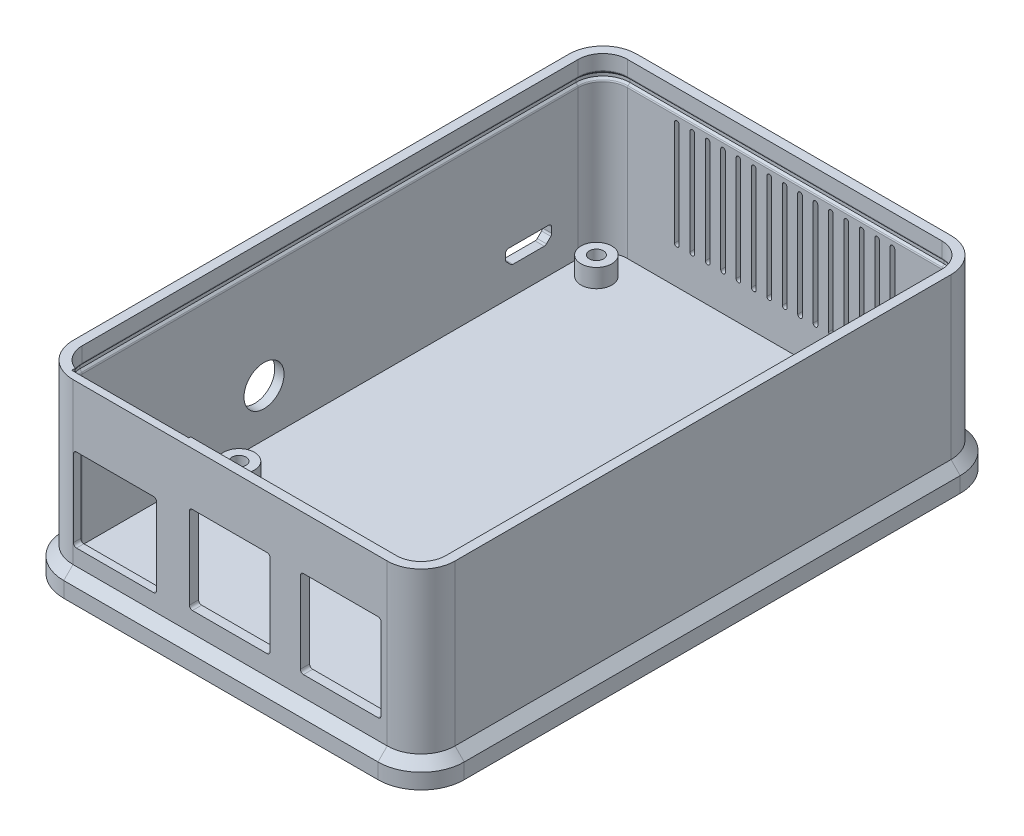
from build123d import *

# Parameters (mm, degrees)
BOSS_EXTRUDE1_DEPTH      = 25
BOSS_EXTRUDE1_DEPTH_BACK = 3
BOSS_EXTRUDE2_START      = 2
BOSS_EXTRUDE2_DEPTH      = 2
SKETCH7_R                = 3.25
CUT_EXTRUDE1_DEPTH       = 1.5
FILLET1_R                = 0.5
SKETCH8_W                = 13.1
SKETCH8_H                = 14.2
SKETCH8_W_2              = 13.5
SKETCH8_H_2              = 13.5
CUT_EXTRUDE2_DEPTH       = 1.5
FILLET2_R                = 0.5
CUT_EXTRUDE3_DEPTH       = 64.158530699
SKETCH10_R               = 2.5
SKETCH10_R_2             = 1.15
BOSS_EXTRUDE4_DEPTH      = 3
BOSS_EXTRUDE7_DEPTH      = 4
CHAMFER2_SIZE            = 1.5
FILLET3_R                = 0.3
CUT_EXTRUDE4_DEPTH       = 1.5
LPATTERN1_COUNT          = 8
LPATTERN1_PITCH          = 2.5
LPATTERN1_COL_COUNT      = 8
LPATTERN1_COL_PITCH      = 2.5


with BuildPart() as part:
    # Sketch1 → Boss-Extrude1 (new, two sides: drawn at the far end of the back side and taken through both)
    with BuildSketch(Plane(origin=(0, 0, 0), x_dir=(1, 0, 0), z_dir=(0, 1, 0)).offset(-BOSS_EXTRUDE1_DEPTH_BACK)):
        with BuildLine():
            Line((-29, 40), (-29, -40.5))
            ThreePointArc((-29, -40.5), (-27.389087297, -44.389087297), (-23.5, -46))
            Line((-23.5, -46), (27.5, -46))
            ThreePointArc((27.5, -46), (31.389087297, -44.389087297), (33, -40.5))
            Line((33, -40.5), (33, 40))
            ThreePointArc((33, 40), (31.389087297, 43.889087297), (27.5, 45.5))
            Line((27.5, 45.5), (-23.5, 45.5))
            ThreePointArc((-23.5, 45.5), (-27.389087297, 43.889087297), (-29, 40))
        make_face()
        with BuildLine():
            Line((-23.5, 44), (27.5, 44))
            ThreePointArc((27.5, 44), (30.328427125, 42.828427125), (31.5, 40))
            Line((31.5, 40), (31.5, -40.5))
            ThreePointArc((31.5, -40.5), (30.328427125, -43.328427125), (27.5, -44.5))
            Line((27.5, -44.5), (-23.5, -44.5))
            ThreePointArc((-23.5, -44.5), (-26.328427125, -43.328427125), (-27.5, -40.5))
            Line((-27.5, -40.5), (-27.5, 40))
            ThreePointArc((-27.5, 40), (-26.328427125, 42.828427125), (-23.5, 44))
        make_face(mode=Mode.SUBTRACT)
    extrude(amount=BOSS_EXTRUDE1_DEPTH + BOSS_EXTRUDE1_DEPTH_BACK)

    # Sketch2 → Boss-Extrude2 (add)
    with BuildSketch(Plane.XZ.offset(3).offset(BOSS_EXTRUDE2_START)):
        with BuildLine():
            Line((-23.5, -45.5), (27.5, -45.5))
            ThreePointArc((27.5, -45.5), (31.389087297, -43.889087297), (33, -40))
            Line((33, -40), (33, 40.5))
            ThreePointArc((33, 40.5), (31.389087297, 44.389087297), (27.5, 46))
            Line((27.5, 46), (-23.5, 46))
            ThreePointArc((-23.5, 46), (-27.389087297, 44.389087297), (-29, 40.5))
            Line((-29, 40.5), (-29, -40))
            ThreePointArc((-29, -40), (-27.389087297, -43.889087297), (-23.5, -45.5))
        make_face()
    extrude(amount=-BOSS_EXTRUDE2_DEPTH)

    # Sketch7 → Cut-Extrude1 (cut)
    with BuildSketch(Plane.ZY.offset(29)):
        with Locations((11, 4.65)):
            Circle(SKETCH7_R)
        Polygon((-35.7, 4.1), (-35.7, 2.5), (-34.7, 1.5), (-29.2, 1.5), (-28.2, 2.5), (-28.2, 4.1), align=None)
    extrude(amount=-CUT_EXTRUDE1_DEPTH, mode=Mode.SUBTRACT)

    # Fillet1
    fillet1_edges = [part.edges().sort_by_distance(p)[0] for p in [
        (-28.25, 4.1, -35.7),
        (-28.25, 4.1, -28.2),
        (-28.25, 2.5, -28.2),
        (-28.25, 1.5, -29.2),
        (-28.25, 1.5, -34.7),
        (-28.25, 2.5, -35.7),
    ]]
    fillet(fillet1_edges, radius=FILLET1_R)

    # Sketch8 → Cut-Extrude2 (cut)
    with BuildSketch(Plane.XY.offset(46)):
        with Locations((19.95, 9.33)):
            Rectangle(SKETCH8_W, SKETCH8_H)
        with Locations((1.93, 9.33)):
            Rectangle(SKETCH8_W, SKETCH8_H)
        with Locations((-16.69, 8.35)):
            Rectangle(SKETCH8_W_2, SKETCH8_H_2)
    extrude(amount=-CUT_EXTRUDE2_DEPTH, mode=Mode.SUBTRACT)

    # Fillet2
    fillet2_edges = [part.edges().sort_by_distance(p)[0] for p in [
        (13.4, 2.23, 45.25),
        (13.4, 16.43, 45.25),
        (26.5, 16.43, 45.25),
        (26.5, 2.23, 45.25),
        (8.48, 16.43, 45.25),
        (8.48, 2.23, 45.25),
        (-4.62, 2.23, 45.25),
        (-4.62, 16.43, 45.25),
        (-23.44, 1.6, 45.25),
        (-23.44, 15.1, 45.25),
        (-9.94, 15.1, 45.25),
        (-9.94, 1.6, 45.25),
    ]]
    fillet(fillet2_edges, radius=FILLET2_R)

    # Sketch9 → Cut-Extrude3 (cut, through all)
    with BuildSketch(Plane(origin=(0, -3, 0), x_dir=(1, 0, 0), z_dir=(0, 1, 0))):
        with BuildLine():
            Line((-24.9, -44.8), (-5.9, -44.8))
            Line((-5.9, -44.8), (-5.9, -44.5))
            Line((-5.9, -44.5), (-23.5, -44.5))
            ThreePointArc((-23.5, -44.5), (-24.211338458, -44.436241557), (-24.9, -44.246998799))
            Line((-24.9, -44.246998799), (-24.9, -44.8))
        make_face()
    extrude(amount=CUT_EXTRUDE3_DEPTH, mode=Mode.SUBTRACT)

    # Sketch10 → Boss-Extrude4 (add)
    # profile 1 of 4: a face of its own
    with BuildSketch(Plane(origin=(0, -3, 0), x_dir=(1, 0, 0), z_dir=(0, 1, 0))):
        with Locations(Location((-23.551685991, 39, 0), (0, 0, 90))):
            Circle(SKETCH10_R)
        with Locations(Location((-23.551685991, 39, 0), (0, 0, 270))):
            Circle(SKETCH10_R_2, mode=Mode.SUBTRACT)
    # profile 2 of 4: a face of its own
    with BuildSketch(Plane(origin=(0, -3, 0), x_dir=(1, 0, 0), z_dir=(0, 1, 0))):
        with Locations(Location((25.448314009, 39, 0), (0, 0, 90))):
            Circle(SKETCH10_R)
        with Locations(Location((25.448314009, 39, 0), (0, 0, 270))):
            Circle(SKETCH10_R_2, mode=Mode.SUBTRACT)
    # profile 3 of 4: a face of its own
    with BuildSketch(Plane(origin=(0, -3, 0), x_dir=(1, 0, 0), z_dir=(0, 1, 0))):
        with Locations(Location((25.448314009, -19, 0), (0, 0, 90))):
            Circle(SKETCH10_R)
        with Locations(Location((25.448314009, -19, 0), (0, 0, 270))):
            Circle(SKETCH10_R_2, mode=Mode.SUBTRACT)
    # profile 4 of 4: a face of its own
    with BuildSketch(Plane(origin=(0, -3, 0), x_dir=(1, 0, 0), z_dir=(0, 1, 0))):
        with Locations(Location((-23.551685991, -19, 0), (0, 0, 90))):
            Circle(SKETCH10_R)
        with Locations(Location((-23.551685991, -19, 0), (0, 0, 270))):
            Circle(SKETCH10_R_2, mode=Mode.SUBTRACT)
    extrude(amount=BOSS_EXTRUDE4_DEPTH)

    # Sketch15 → Boss-Extrude7 (add)
    with BuildSketch(Plane.XZ.offset(5)):
        with BuildLine():
            Line((-30.5, 40.5), (-30.5, -40))
            ThreePointArc((-30.5, -40), (-28.449747468, -44.949747468), (-23.5, -47))
            Line((-23.5, -47), (27.5, -47))
            ThreePointArc((27.5, -47), (32.449747468, -44.949747468), (34.5, -40))
            Line((34.5, -40), (34.5, 40.5))
            ThreePointArc((34.5, 40.5), (32.449747468, 45.449747468), (27.5, 47.5))
            Line((27.5, 47.5), (-23.5, 47.5))
            ThreePointArc((-23.5, 47.5), (-28.449747468, 45.449747468), (-30.5, 40.5))
        make_face()
        with BuildLine():
            Line((-23.5, -45.5), (27.5, -45.5))
            ThreePointArc((27.5, -45.5), (31.389087297, -43.889087297), (33, -40))
            Line((33, -40), (33, 40.5))
            ThreePointArc((33, 40.5), (31.389087297, 44.389087297), (27.5, 46))
            Line((27.5, 46), (-23.5, 46))
            ThreePointArc((-23.5, 46), (-27.389087297, 44.389087297), (-29, 40.5))
            Line((-29, 40.5), (-29, -40))
            ThreePointArc((-29, -40), (-27.389087297, -43.889087297), (-23.5, -45.5))
        make_face(mode=Mode.SUBTRACT)
    extrude(amount=-BOSS_EXTRUDE7_DEPTH)

    # Chamfer2
    chamfer2_edges = [part.edges().sort_by_distance(p)[0] for p in [
        (-28.449747468, -1, 45.449747468),
        (2, -1, 47.5),
        (32.449747468, -1, 45.449747468),
        (34.5, -1, 0.25),
        (32.449747468, -1, -44.949747468),
        (2, -1, -47),
        (-28.449747468, -1, -44.949747468),
        (-30.5, -1, 0.25),
    ]]
    chamfer(chamfer2_edges, length=CHAMFER2_SIZE - 0.0001)  # a hair under: the kernel refuses the full size

    # Cut-Sweep1: sweep along a path in Sketch18
    with BuildLine(Plane(origin=(0, 21.55, 0), x_dir=(1, 0, 0), z_dir=(0, 1, 0))) as cut_sweep1_path:
        Line((-27.5, 40), (-27.5, -40.5))
        ThreePointArc((-27.5, -40.5), (-26.328427125, -43.328427125), (-23.5, -44.5))
        Line((-23.5, -44.5), (27.5, -44.5))
        ThreePointArc((27.5, -44.5), (30.328427125, -43.328427125), (31.5, -40.5))
        Line((31.5, -40.5), (31.5, 40))
        ThreePointArc((31.5, 40), (30.328427125, 42.828427125), (27.5, 44))
        Line((27.5, 44), (-23.5, 44))
        ThreePointArc((-23.5, 44), (-26.328427125, 42.828427125), (-27.5, 40))
    # Sketch17 → Cut-Sweep1 (sweep, cut)
    with BuildSketch(Plane.XY):
        Polygon((-27.5, 22.45), (-27.9, 22.05), (-27.9, 21.55), (-27.5, 21.15), align=None)
    sweep(path=cut_sweep1_path.line, mode=Mode.SUBTRACT)

    # Fillet3
    fillet3_edges = [part.edges().sort_by_distance(p)[0] for p in [
        (10.8, 21.15, 44.5),
        (30.328427125, 21.15, 43.328427125),
        (31.5, 21.15, 0.25),
        (30.328427125, 21.15, -42.828427125),
        (2, 21.15, -44),
        (-26.328427125, 21.15, -42.828427125),
        (-26.786335345, 21.15, 42.78035085),
        (10.8, 22.45, 44.5),
        (30.328427125, 22.45, 43.328427125),
        (31.5, 22.45, 0.25),
        (30.328427125, 22.45, -42.828427125),
        (2, 22.45, -44),
        (-26.328427125, 22.45, -42.828427125),
        (-26.786335345, 22.45, 42.78035085),
        (-27.5, 21.15, 0.25),
        (-27.5, 22.45, 0.25),
    ]]
    fillet(fillet3_edges, radius=FILLET3_R)

    # Sketch19 → Cut-Extrude4 (cut)
    with BuildSketch(Plane(origin=(0, 0, -45.5), x_dir=(-1, 0, 0), z_dir=(0, 0, -1))):
        with BuildLine():
            Line((-1.625, 20), (-1.625, 3))
            ThreePointArc((-1.625, 3), (-2, 2.625), (-2.375, 3))
            Line((-2.375, 3), (-2.375, 20))
            ThreePointArc((-2.375, 20), (-2, 20.375), (-1.625, 20))
        make_face()
    cut_extrude4 = extrude(amount=-CUT_EXTRUDE4_DEPTH, mode=Mode.SUBTRACT)

    # LPattern1: Cut-Extrude4 ×8
    with Locations(*[(-i * LPATTERN1_PITCH, 0, 0) for i in range(1, LPATTERN1_COUNT)]):
        add(cut_extrude4, mode=Mode.SUBTRACT)

    # LPattern1 col: Cut-Extrude4 ×8
    with Locations(*[(i * LPATTERN1_COL_PITCH, 0, 0) for i in range(1, LPATTERN1_COL_COUNT)]):
        add(cut_extrude4, mode=Mode.SUBTRACT)


solid = part.part
